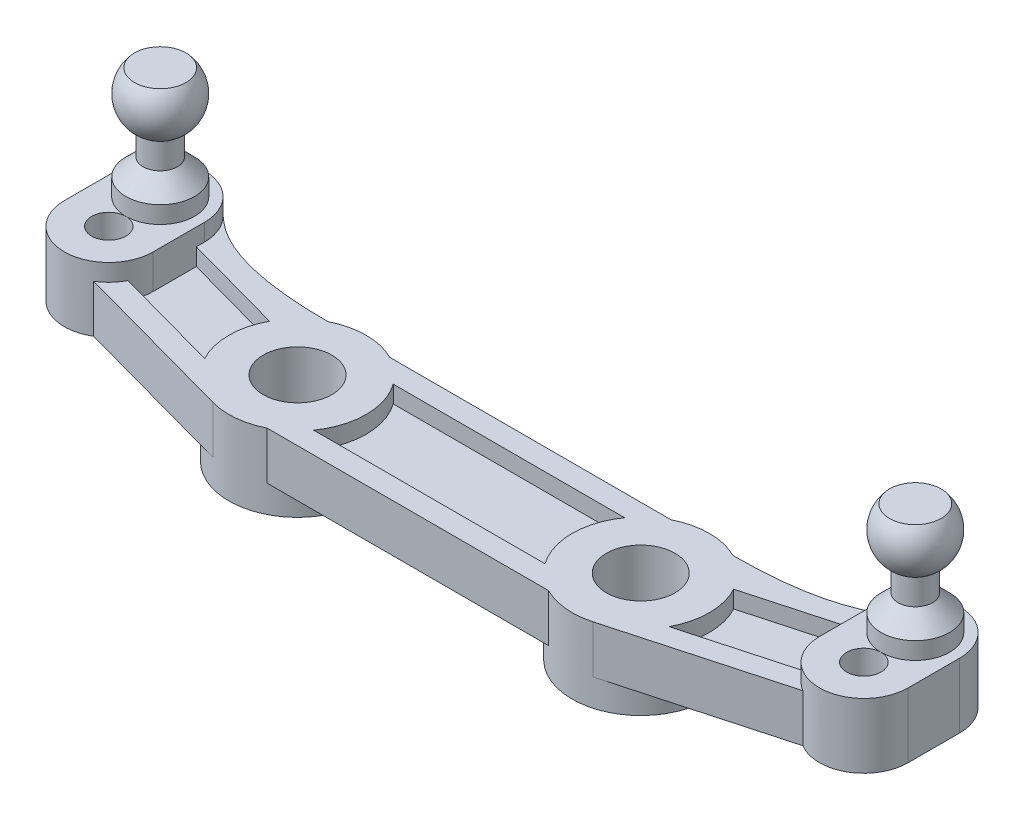
from build123d import *
from build123d.topology import SkipClean

# Parameters (mm, degrees)
SKETCH1_R           = 1
SKETCH1_R_2         = 2
BOSS_EXTRUDE1_DEPTH = 2.778125
SKETCH2_R           = 1
BOSS_EXTRUDE2_DEPTH = 1
CUT_EXTRUDE1_START  = -1
CUT_EXTRUDE1_DEPTH  = 1
BOSS_EXTRUDE3_START = 1.5875
SKETCH4_R           = 2
BOSS_EXTRUDE3_DEPTH = 1.5875
BOSS_EXTRUDE4_START = 1.5875
BOSS_EXTRUDE4_DEPTH = 1.5875
CUT_EXTRUDE2_DEPTH  = 1.5875
SKETCH7_W           = 1
SKETCH7_H           = 0.5
SKETCH8_W           = 1
SKETCH8_H           = 0.5


# Read off the part's stored shape, not the designer's step: Mirror3
with BuildPart() as part:
    # Sketch1 → Boss-Extrude1 (new body)
    with BuildSketch(Plane(origin=(0, 0, 0), x_dir=(1, 0, 0), z_dir=(0, 1, 0))):
        with BuildLine():
            ThreePointArc((20.661985619, -1.21469496), (23.271425192, -1.253582532), (24.5875, 1))
            Line((24.5875, 1), (24.5875, 4))
            ThreePointArc((24.5875, 4), (23.073332343, 6.354381858), (20.302967493, 5.953263146))
            Line((20.302967493, 5.953263146), (19.841851108, 5.552636382))
            add(Edge.make_bspline(
                [(11.800474655, 3.571875), (13.90833466, 3.571875), (17.75855835, 3.742631652), (19.841851108, 5.552636382)],
                knots=[0, 0, 0, 0, 1, 1, 1, 1], degree=3))
            ThreePointArc((11.800474655, 3.571875), (10, 4), (8.199525345, 3.571875))
            Line((8.199525345, 3.571875), (-8.199525345, 3.571875))
            ThreePointArc((-8.199525345, 3.571875), (-10, 4), (-11.800474655, 3.571875))
            add(Edge.make_bspline(
                [(-11.800474655, 3.571875), (-13.90833466, 3.571875), (-17.75855835, 3.742631652), (-19.841851108, 5.552636382)],
                knots=[0, 0, 0, 0, 1, 1, 1, 1], degree=3))
            Line((-19.841851108, 5.552636382), (-20.302967493, 5.953263146))
            ThreePointArc((-20.302967493, 5.953263146), (-23.073332343, 6.354381858), (-24.5875, 4))
            Line((-24.5875, 4), (-24.5875, 1))
            ThreePointArc((-24.5875, 1), (-23.271425192, -1.253582532), (-20.661985619, -1.21469496))
            Line((-20.661985619, -1.21469496), (-11.061280458, -3.856641517))
            ThreePointArc((-11.061280458, -3.856641517), (-9.603925503, -3.980342321), (-8.199525345, -3.571875))
            Line((-8.199525345, -3.571875), (8.199525345, -3.571875))
            ThreePointArc((8.199525345, -3.571875), (9.603925503, -3.980342321), (11.061280458, -3.856641517))
            Line((11.061280458, -3.856641517), (20.661985619, -1.21469496))
        make_face()
        with Locations(Location((-22, 1, 0), (0, 0, 270))):
            Circle(SKETCH1_R, mode=Mode.SUBTRACT)
        with Locations(Location((-10, 0, 0), (0, 0, 270))):
            Circle(SKETCH1_R_2, mode=Mode.SUBTRACT)
        with Locations(Location((10, 0, 0), (0, 0, 270))):
            Circle(SKETCH1_R_2, mode=Mode.SUBTRACT)
        with Locations(Location((-22, 4, 0), (0, 0, 270))):
            Circle(SKETCH1_R, mode=Mode.SUBTRACT)
        with Locations(Location((22, 1, 0), (0, 0, 270))):
            Circle(SKETCH1_R, mode=Mode.SUBTRACT)
        with Locations(Location((22, 4, 0), (0, 0, 270))):
            Circle(SKETCH1_R, mode=Mode.SUBTRACT)
    extrude(amount=BOSS_EXTRUDE1_DEPTH)

    # Sketch2 → Boss-Extrude2 (add)
    with BuildSketch(Plane(origin=(0, 2.778125, 0), x_dir=(1, 0, 0), z_dir=(0, 1, 0))):
        with BuildLine():
            ThreePointArc((-24.5875, 1), (-22, -1.5875), (-19.4125, 1))
            Line((-19.4125, 1), (-19.4125, 4))
            ThreePointArc((-19.4125, 4), (-22, 6.5875), (-24.5875, 4))
            Line((-24.5875, 4), (-24.5875, 1))
        make_face()
        with Locations((-22, 1)):
            Circle(SKETCH2_R, mode=Mode.SUBTRACT)
        with Locations((-22, 4)):
            Circle(SKETCH2_R, mode=Mode.SUBTRACT)
    boss_extrude2 = extrude(amount=BOSS_EXTRUDE2_DEPTH)

    # Mirror1: Boss-Extrude2 across plane
    with SkipClean():  # the faces are left unmerged after this step: merging them gives an invalid solid
        add(boss_extrude2.mirror(Plane(origin=(0, 0, 0), x_dir=(0, 0, 1), z_dir=(1, 0, 0))))

    # Sketch3 → Cut-Extrude1 (cut)
    with SkipClean():  # the faces are left unmerged after this step: merging them gives an invalid solid
        with BuildSketch(Plane(origin=(0, 2.778125, 0), x_dir=(1, 0, 0), z_dir=(0, 1, 0)).offset(CUT_EXTRUDE1_START)):
            with BuildLine():
                Line((-19.698899277, -0.183254711), (-13.530263134, -1.880755754))
                ThreePointArc((-13.530263134, -1.880755754), (-13.999992711, 0.007636121), (-13.523056576, 1.89422078))
                Line((-13.523056576, 1.89422078), (-19.4125, 3.514892857))
                Line((-19.4125, 3.514892857), (-19.4125, 1))
                ThreePointArc((-19.4125, 1), (-19.485118853, 0.391289014), (-19.698899277, -0.183254711))
            make_face()
            with BuildLine():
                ThreePointArc((-6.742869901, 2.321875), (-6, 0), (-6.742869901, -2.321875))
                Line((-6.742869901, -2.321875), (6.742869901, -2.321875))
                ThreePointArc((6.742869901, -2.321875), (6, 0), (6.742869901, 2.321875))
                Line((6.742869901, 2.321875), (-6.742869901, 2.321875))
            make_face()
            with BuildLine():
                ThreePointArc((13.523056576, 1.89422078), (13.999992711, 0.007636121), (13.530263134, -1.880755754))
                Line((13.530263134, -1.880755754), (19.698899277, -0.183254711))
                ThreePointArc((19.698899277, -0.183254711), (19.485118853, 0.391289014), (19.4125, 1))
                Line((19.4125, 1), (19.4125, 3.514892857))
                Line((19.4125, 3.514892857), (13.523056576, 1.89422078))
            make_face()
        extrude(amount=CUT_EXTRUDE1_DEPTH, mode=Mode.SUBTRACT)

    # Sketch4 → Boss-Extrude3 (add)
    # profile 1 of 4: a face of its own
    with SkipClean():  # the faces are left unmerged after this step: merging them gives an invalid solid
        with BuildSketch(Plane.XZ.offset(BOSS_EXTRUDE3_START)):
            with BuildLine():
                ThreePointArc((-6, 0), (-6.019936137, 0.398862947), (-6.079545825, 0.79375))
                ThreePointArc((-6.079545825, 0.79375), (-6.820101999, 2.426571388), (-8.199525345, 3.571875))
                ThreePointArc((-8.199525345, 3.571875), (-9.603925503, 3.980342321), (-11.061280458, 3.856641517))
                ThreePointArc((-11.061280458, 3.856641517), (-13.980342321, 0.396074497), (-11.800474655, -3.571875))
                ThreePointArc((-11.800474655, -3.571875), (-10, -4), (-8.199525345, -3.571875))
                ThreePointArc((-8.199525345, -3.571875), (-6.820101999, -2.426571388), (-6.079545825, -0.79375))
                ThreePointArc((-6.079545825, -0.79375), (-6.019936137, -0.398862947), (-6, 0))
            make_face()
            with Locations(Location((-10, 0, 0), (0, 0, 270))):
                Circle(SKETCH4_R, mode=Mode.SUBTRACT)
        # profile 2 of 4: a face of its own
        with BuildSketch(Plane.XZ.offset(BOSS_EXTRUDE3_START)):
            with BuildLine():
                Line((0, 0.79375), (-6.079545825, 0.79375))
                ThreePointArc((-6.079545825, 0.79375), (-6.019936137, 0.398862947), (-6, 0))
                ThreePointArc((-6, 0), (-6.019936137, -0.398862947), (-6.079545825, -0.79375))
                Line((-6.079545825, -0.79375), (0, -0.79375))
                Line((0, -0.79375), (0, 0.79375))
            make_face()
        # profile 3 of 4: a face of its own
        with BuildSketch(Plane.XZ.offset(BOSS_EXTRUDE3_START)):
            with BuildLine():
                Line((6.079545825, 0.79375), (0, 0.79375))
                Line((0, 0.79375), (0, -0.79375))
                Line((0, -0.79375), (6.079545825, -0.79375))
                ThreePointArc((6.079545825, -0.79375), (6, 0), (6.079545825, 0.79375))
            make_face()
        # profile 4 of 4: a face of its own
        with BuildSketch(Plane.XZ.offset(BOSS_EXTRUDE3_START)):
            with BuildLine():
                ThreePointArc((8.199525345, 3.571875), (6.820101999, 2.426571388), (6.079545825, 0.79375))
                ThreePointArc((6.079545825, 0.79375), (6, 0), (6.079545825, -0.79375))
                ThreePointArc((6.079545825, -0.79375), (6.820101999, -2.426571388), (8.199525345, -3.571875))
                ThreePointArc((8.199525345, -3.571875), (10, -4), (11.800474655, -3.571875))
                ThreePointArc((11.800474655, -3.571875), (13.406016634, -2.097391401), (14, 0))
                ThreePointArc((14, 0), (13.181597227, 2.424343021), (11.061280458, 3.856641517))
                ThreePointArc((11.061280458, 3.856641517), (9.603925503, 3.980342321), (8.199525345, 3.571875))
            make_face()
            with Locations(Location((10, 0, 0), (0, 0, 270))):
                Circle(SKETCH4_R, mode=Mode.SUBTRACT)
        extrude(amount=-BOSS_EXTRUDE3_DEPTH)

    # Sketch5 → Boss-Extrude4 (add)
    with SkipClean():  # the faces are left unmerged after this step: merging them gives an invalid solid
        with BuildSketch(Plane.XZ.offset(BOSS_EXTRUDE4_START)):
            with BuildLine():
                ThreePointArc((-13.869431572, -1.013656406), (-13.994679794, -0.206236131), (-13.953246353, 0.609789534))
                Line((-13.953246353, 0.609789534), (-19.832609512, -1.00810863))
                Line((-19.832609512, -1.00810863), (-19.41141383, -2.538713232))
                Line((-19.41141383, -2.538713232), (-13.869431572, -1.013656406))
            make_face()
        boss_extrude4 = extrude(amount=-BOSS_EXTRUDE4_DEPTH)

    # Sketch6 → Cut-Extrude2 (cut)
    with SkipClean():  # the faces are left unmerged after this step: merging them gives an invalid solid
        with BuildSketch(Plane(origin=(-0.717030749, 0, 2.605654831), x_dir=(-0.964160379177711, 0, -0.26532011462362337), z_dir=(0.2653201146236233, 0, -0.9641603791777109))):
            with BuildLine():
                add(Edge.make_bspline(
                    [(13.641299837, -1.5875), (18.723719218, 0), (19.389287804, 0)],
                    knots=[0, 0, 0, 1, 1, 1], degree=2))
                Line((19.389287804, 0), (19.389287804, -1.5875))
                Line((19.389287804, -1.5875), (13.641299837, -1.5875))
            make_face()
        cut_extrude2 = extrude(amount=-CUT_EXTRUDE2_DEPTH, mode=Mode.SUBTRACT)

    # Mirror2: Boss-Extrude4, Cut-Extrude2 across plane
    with SkipClean():  # the faces are left unmerged after this step: merging them gives an invalid solid
        add(boss_extrude4.mirror(Plane(origin=(0, 0, 0), x_dir=(0, 0, 1), z_dir=(1, 0, 0))))
        add(cut_extrude2.mirror(Plane(origin=(0, 0, 0), x_dir=(0, 0, 1), z_dir=(1, 0, 0))), mode=Mode.SUBTRACT)

    # Mirror3 outline → Mirror3 (revolve)
    with SkipClean():  # the faces are left unmerged after this step: merging them gives an invalid solid
        with BuildSketch(Plane(origin=(22, 0, -4), x_dir=(1, 0, 0), z_dir=(0, 0, 1))):
            with BuildLine():
                Line((0, 10.278125), (0, 3.778125))
                Line((0, 3.778125), (2, 3.778125))
                Line((2, 3.778125), (2, 4.778125))
                Line((2, 4.778125), (1, 5.778125))
                Line((1, 5.778125), (1, 7.278125))
                ThreePointArc((1, 7.278125), (1.973563065, 8.657531156), (1.5, 10.278125))
                Line((1.5, 10.278125), (0, 10.278125))
            make_face()
        revolve(axis=Axis((22, 0, -4), (0, 1, 0)))


with BuildPart() as body_2:
    # Sketch7 → Revolve1 (revolve)
    with BuildSketch(Plane.XY.offset(-4), mode=Mode.PRIVATE) as revolve1_sk:
        with BuildLine():
            Line((-22, 10.278125), (-23.5, 10.278125))
            ThreePointArc((-23.5, 10.278125), (-23.973563065, 8.657531156), (-23, 7.278125))
            Line((-23, 7.278125), (-23, 5.778125))
            Line((-23, 5.778125), (-24, 4.778125))
            Line((-24, 4.778125), (-24, 3.778125))
            Line((-24, 3.778125), (-22, 3.778125))
            Line((-22, 3.778125), (-22, 10.278125))
        make_face()
        with Locations((-22.5, -0.25)):
            Rectangle(SKETCH7_W, SKETCH7_H)
    revolve(revolve1_sk.sketch.rotate(Axis((-22, 3.778125, -4), (0, -1, 0)), 270), axis=Axis((-22, 3.778125, -4), (0, -1, 0)))


with BuildPart() as body_3:
    # Sketch8 → Revolve2 (revolve)
    with BuildSketch(Plane.XY.offset(-4), mode=Mode.PRIVATE) as revolve2_sk:
        with Locations((21.5, -0.25)):
            Rectangle(SKETCH8_W, SKETCH8_H)
    revolve(revolve2_sk.sketch.rotate(Axis((22, 3.778125, -4), (0, -1, 0)), 270), axis=Axis((22, 3.778125, -4), (0, -1, 0)))


solid = Compound([part.part, body_2.part, body_3.part])
